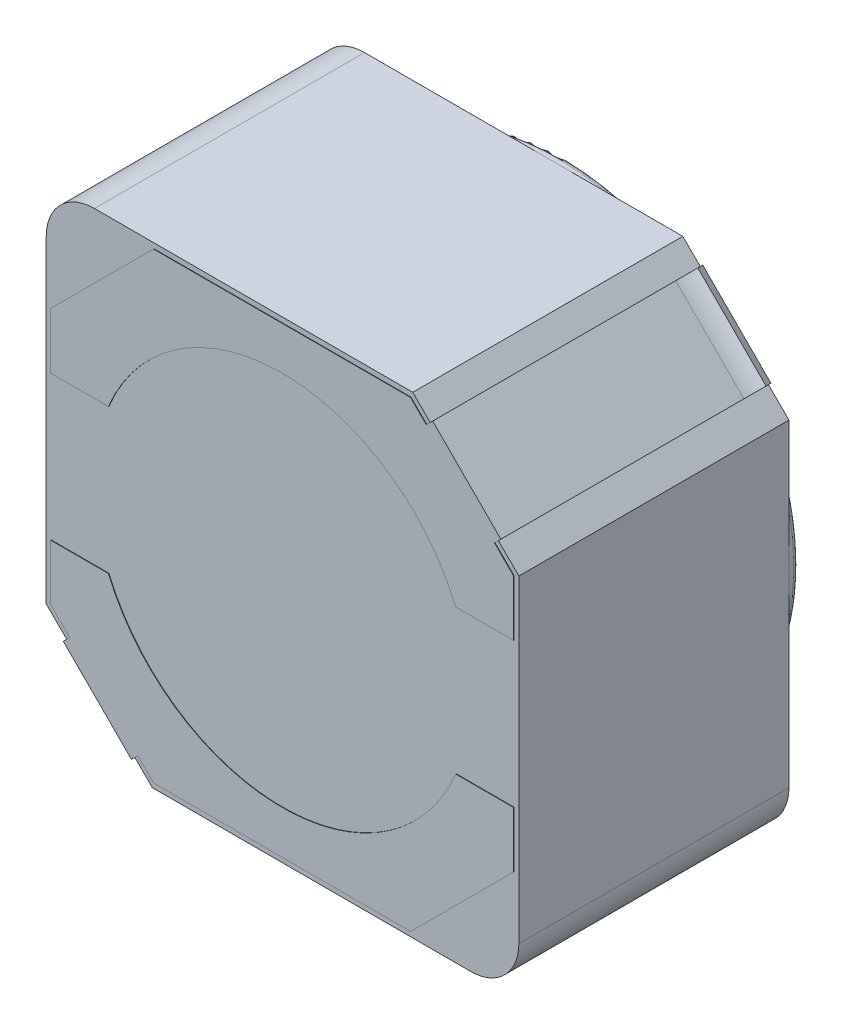
from build123d import *

# Parameters (mm, degrees)
EXTRUDE_START             = -0.005
EXTRUDE_1_DEPTH           = 2.8
EXTRUDE_2_DEPTH           = 0.1
EXTRUDE_2_DEPTH_BACK      = 1
SKETCH_2_R                = 2.45
FILLET_1_R                = 0.05
EXTRUDE_START_2           = 0.3
EXTRUDE_6_DEPTH           = 1
CUT_EXTRUDE_8_DEPTH       = 0.2
EXTRUDE_START_3           = 0.05
SKETCH_9_R                = 0.045863928
EXTRUDE_9_DEPTH           = 0.460735
EXTRUDE_9_OTHER_WAY_DEPTH = 0.05
EXTRUDE_9_OTHER_WAY_TAPER = -30
PATTERN_CIRCULAR_3_COUNT  = 2
EXTRUDE_12_DEPTH          = 0.005


# Read off the part's stored shape, not the designer's step: Вытянуть11
with BuildPart() as part:
    # Эскиз1 → Вытянуть1 (new body)
    with BuildSketch(Plane.XY.offset(EXTRUDE_START)):
        with BuildLine():
            Line((-2.45, -1.35), (-1.35, -2.45))
            Line((-1.35, -2.45), (1.95, -2.45))
            ThreePointArc((1.95, -2.45), (2.303553391, -2.303553391), (2.45, -1.95))
            Line((2.45, -1.95), (2.45, 1.35))
            Line((2.45, 1.35), (1.35, 2.45))
            Line((1.35, 2.45), (-1.95, 2.45))
            ThreePointArc((-1.95, 2.45), (-2.303553391, 2.303553391), (-2.45, 1.95))
            Line((-2.45, 1.95), (-2.45, -1.35))
        make_face()
    extrude(amount=-EXTRUDE_1_DEPTH)

    # Эскиз2 → Вытянуть2 (add, two sides: drawn at the far end of the back side and taken through both)
    with BuildSketch(Plane(origin=(0, 0, -2.805), x_dir=(-1, 0, 0), z_dir=(0, 0, -1)).offset(-EXTRUDE_2_DEPTH_BACK)):
        Circle(SKETCH_2_R)
    extrude(amount=EXTRUDE_2_DEPTH + EXTRUDE_2_DEPTH_BACK)

    # Скругление1
    fillet_1_edges = [part.edges().sort_by_distance(p)[0] for p in [
        (2.45, 0, -2.905),
    ]]
    fillet(fillet_1_edges, radius=FILLET_1_R)

    # Эскиз6 → Вытянуть6 (add)
    with BuildSketch(Plane(origin=(0.55, -0.55, 0), x_dir=(0, 0, 1), z_dir=(-0.7071067811865498, 0.7071067811865452, 0)).offset(EXTRUDE_START_2)):
        with BuildLine():
            Line((-2.712480612, 2.782369178), (-2.8, 2.73))
            Line((-2.8, 2.73), (-2.8, 2.7))
            Line((-2.8, 2.7), (-0.030179797, 2.7))
            Line((-0.030179797, 2.7), (-0.030179797, 2.2))
            Line((-0.030179797, 2.2), (0, 2.2))
            Line((0, 2.2), (0, 2.73))
            Line((0, 2.73), (-2.519857711, 2.73))
            add(Edge.make_bspline(
                [(-2.519857711, 2.73), (-2.623929678, 2.733012128), (-2.712480612, 2.782369178)],
                knots=[0, 0, 0, 1, 1, 1], degree=2))
        make_face()
    extrude_6 = extrude(amount=EXTRUDE_6_DEPTH)

    # Эскиз8 → Вытянуть8 (cut)
    with BuildSketch(Plane(origin=(0, 0, -2.805), x_dir=(-1, 0, 0), z_dir=(0, 0, -1))):
        Polygon((-1.67106601, 2.12893399), (-2.095468281, 1.704531719), (-1.707545088, 1.388980588), (-1.318603045, 1.776471025), align=None)
        Polygon((2.095468281, -1.704531719), (1.707545088, -1.388980588), (1.318603045, -1.776471025), (1.67106601, -2.12893399), align=None)
    extrude(amount=-CUT_EXTRUDE_8_DEPTH, mode=Mode.SUBTRACT)

    # Круговой массив3: Вытянуть6 ×2 about axis
    pattern_circular_3_axis = Axis((0, 0, -2.905), (0, 0, 1))
    for i in range(1, PATTERN_CIRCULAR_3_COUNT):
        add(extrude_6.rotate(pattern_circular_3_axis, i * 360 / PATTERN_CIRCULAR_3_COUNT))

    # Вытянуть11 outline → Вытянуть11 (revolve)
    with BuildSketch(Plane(origin=(0.139390265, -0.139390265, -2.66838383), x_dir=(0.7071067811865551, -0.70710678118654, 0), z_dir=(0, 0, 1))):
        Polygon((0, -2.7), (0.079921408, -2.7), (0.051053894, -2.65), (0.051053895, -2.18868786), (0, -2.18868786), align=None)
    revolve(axis=Axis((0.139390265, -0.139390265, -2.66838383), (0.70710678118654, 0.7071067811865551, 0)))

    # Эскиз13 → Вытянуть12 (add)
    with BuildSketch(Plane.XY.offset(-0.005)):
        with BuildLine():
            Line((-2.4, 1.329947834), (-2.4, 0.75))
            Line((-2.4, 0.75), (-1.8, 0.75))
            ThreePointArc((-1.8, 0.75), (0, 1.95), (1.8, 0.75))
            Line((1.8, 0.75), (2.4, 0.75))
            Line((2.4, 0.75), (2.4, 1.328848765))
            Line((2.4, 1.328848765), (1.331878419, 2.396970346))
            Line((1.331878419, 2.396970346), (-1.332977488, 2.396970346))
            Line((-1.332977488, 2.396970346), (-2.4, 1.329947834))
        make_face()
        with BuildLine():
            Line((2.4, -1.329947834), (2.4, -0.75))
            Line((2.4, -0.75), (1.8, -0.75))
            ThreePointArc((1.8, -0.75), (0, -1.95), (-1.8, -0.75))
            Line((-1.8, -0.75), (-2.4, -0.75))
            Line((-2.4, -0.75), (-2.4, -1.328848765))
            Line((-2.4, -1.328848765), (-1.331878419, -2.396970346))
            Line((-1.331878419, -2.396970346), (1.332977488, -2.396970346))
            Line((1.332977488, -2.396970346), (2.4, -1.329947834))
        make_face()
    extrude(amount=EXTRUDE_12_DEPTH)


with BuildPart() as body_2:
    # Эскиз9 → Вытянуть9 (new body)
    with BuildSketch(Plane(origin=(1.909188309, 1.909188309, 0), x_dir=(0, 0, 1), z_dir=(-0.7071067811865452, -0.7071067811865498, 0)).offset(EXTRUDE_START_3)):
        with Locations(Location((-2.704395886, -0.059674036, 0), (0, 0, 270))):
            Circle(SKETCH_9_R)
    extrude(amount=EXTRUDE_9_DEPTH)

    # Эскиз9 → Вытянуть9 other way (add)
    with BuildSketch(Plane(origin=(1.909188309, 1.909188309, 0), x_dir=(0, 0, 1), z_dir=(-0.7071067811865452, -0.7071067811865498, 0)).offset(EXTRUDE_START_3)):
        with Locations(Location((-2.704395886, -0.059674036, 0), (0, 0, 270))):
            Circle(SKETCH_9_R)
    extrude(amount=-EXTRUDE_9_OTHER_WAY_DEPTH, taper=EXTRUDE_9_OTHER_WAY_TAPER)


solid = Compound([part.part, body_2.part])
